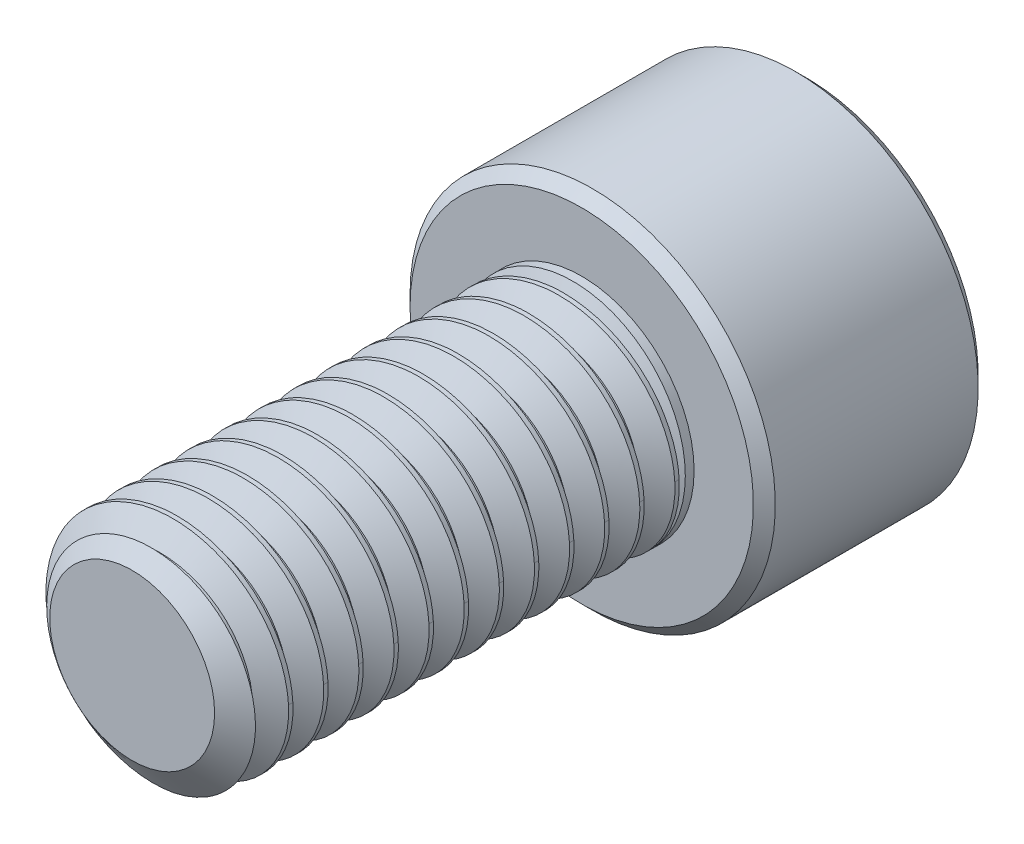
from build123d import *

# Parameters (mm, degrees)
SKETCH1_R          = 4
EXTRUDE1_DEPTH     = 16
CUT_SWEEP1_PITCH   = 1.25
SKETCH6_R          = 6.5
EXTRUDE2_DEPTH     = 8
CUT_EXTRUDE1_DEPTH = 4.5
CHAMFER1_SIZE      = 0.39


with BuildPart() as part:
    # Sketch1 → Extrude1 (new body)
    with BuildSketch(Plane.XY):
        Circle(SKETCH1_R)
    extrude(amount=-EXTRUDE1_DEPTH)

    # Cut-Sweep1: the profile of Sketch3 profile screwed along a right-hand helix of 13.8 turns, 6 arcs to a turn; built about Z, then put on its axis
    cut_sweep1_z = Axis((0, 0, 0), (0, 0, 1))
    cut_sweep1_corners = [(4.0003, 0, -1.093923205), (3.188101184, 0, -0.625), (3.188101184, 0, -0.46875), (4.0003, 0, 0.000173205)]
    with BuildLine(mode=Mode.PRIVATE) as cut_sweep1_profile:
        Line(cut_sweep1_corners[0], cut_sweep1_corners[1])
        Line(cut_sweep1_corners[1], cut_sweep1_corners[2])
        Line(cut_sweep1_corners[2], cut_sweep1_corners[3])
        Line(cut_sweep1_corners[3], cut_sweep1_corners[0])
    cut_sweep1_cap = Face(cut_sweep1_profile.wire())
    cut_sweep1_turn_angles = [0, 30, 60, 90, 120, 150, 180, 210, 240, 270, 300, 330, 360]
    cut_sweep1_turn_weights = [1, 0.8660254037844387, 1, 0.8660254037844387, 1, 0.8660254037844387, 1, 0.8660254037844387, 1, 0.8660254037844387, 1, 0.8660254037844387, 1]
    cut_sweep1_turn_rails = [Edge.make_bspline([Vector(p[0], p[1], 0).rotate(cut_sweep1_z, cut_sweep1_turn_angles[k]) / cut_sweep1_turn_weights[k] + Vector(0, 0, p[2] + CUT_SWEEP1_PITCH * cut_sweep1_turn_angles[k] / 360) for k in range(13)], [0, 0, 0, 1, 1, 2, 2, 3, 3, 4, 4, 5, 5, 6, 6, 6], 2, cut_sweep1_turn_weights) for p in cut_sweep1_corners]
    cut_sweep1_turn_sides = [Face.make_surface_from_curves(cut_sweep1_turn_rails[p[0]], cut_sweep1_turn_rails[p[1]]) for p in [(0, 1), (1, 2), (2, 3), (3, 0)]]
    cut_sweep1_last_angles = [4680, 4710, 4740, 4770, 4800, 4830, 4860, 4890, 4920, 4944, 4968]
    cut_sweep1_last_weights = [1, 0.8660254037844387, 1, 0.8660254037844387, 1, 0.8660254037844387, 1, 0.8660254037844387, 1, 0.9135454576426203, 1]
    cut_sweep1_last_rails = [Edge.make_bspline([Vector(p[0], p[1], 0).rotate(cut_sweep1_z, cut_sweep1_last_angles[k]) / cut_sweep1_last_weights[k] + Vector(0, 0, p[2] + CUT_SWEEP1_PITCH * cut_sweep1_last_angles[k] / 360) for k in range(11)], [0, 0, 0, 1, 1, 2, 2, 3, 3, 4, 4, 5, 5, 5], 2, cut_sweep1_last_weights) for p in cut_sweep1_corners]
    cut_sweep1_last_sides = [Face.make_surface_from_curves(cut_sweep1_last_rails[p[0]], cut_sweep1_last_rails[p[1]]) for p in [(0, 1), (1, 2), (2, 3), (3, 0)]]
    cut_sweep1 = Plane(origin=(0, 0, 0), x_dir=(0, 1, 0), z_dir=(0, 0, -1)) * Solid(Shell([*[p.moved(Location((0, 0, CUT_SWEEP1_PITCH * i))) for i in range(13) for p in cut_sweep1_turn_sides], *cut_sweep1_last_sides, cut_sweep1_cap, cut_sweep1_cap.rotate(cut_sweep1_z, 4968).moved(Location((0, 0, CUT_SWEEP1_PITCH * 4968 / 360)))]))
    add(cut_sweep1, mode=Mode.SUBTRACT)

    # Sketch4 → Cut-Revolve1 (revolve, cut)
    with BuildSketch(Plane(origin=(0, 0, 0), x_dir=(0, 0, -1), z_dir=(1, 0, 0)), mode=Mode.PRIVATE) as cut_revolve1_sk:
        Polygon((0.746350386, 4), (0, 2.934101184), (0, 4), align=None)
    revolve(cut_revolve1_sk.sketch.rotate(Axis((0, 0, 0), (0, 0, -1)), 230.713364492), axis=Axis((0, 0, 0), (0, 0, -1)), mode=Mode.SUBTRACT)

    # Sketch6 → Extrude2 (add)
    with BuildSketch(Plane(origin=(0, 0, -16), x_dir=(-1, 0, 0), z_dir=(0, 0, -1))):
        Circle(SKETCH6_R)
    extrude(amount=EXTRUDE2_DEPTH)

    # Sketch7 → Cut-Extrude1 (cut)
    with BuildSketch(Plane(origin=(0, 0, -24), x_dir=(-1, 0, 0), z_dir=(0, 0, -1))):
        Polygon((0, 3.464101615), (-3, 1.732050808), (-3, -1.732050808), (0, -3.464101615), (3, -1.732050808), (3, 1.732050808), align=None)
    extrude(amount=-CUT_EXTRUDE1_DEPTH, mode=Mode.SUBTRACT)

    # Cut-Extrude2 cone 1 section (through the dimple's axis) → Cut-Extrude2 (revolve, cut)
    with BuildSketch(Plane(origin=(0, 0, -24), x_dir=(0, 1, 0), z_dir=(1, 0, 0))):
        Polygon((0, 0), (3.464101615, 0), (0, 3.464101615), align=None)
    revolve(axis=Axis((0, 0, -24), (0, 0, 1)), mode=Mode.SUBTRACT)

    # Chamfer1
    chamfer1_edges = [part.edges().sort_by_distance(p)[0] for p in [
        (6.5, 0, -16),
        (6.5, 0, -24),
    ]]
    chamfer(chamfer1_edges, length=CHAMFER1_SIZE)

    # Sketch10 → Revolve1 (revolve)
    with BuildSketch(Plane(origin=(0, 0, 0), x_dir=(0, 0, -1), z_dir=(1, 0, 0)), mode=Mode.PRIVATE) as revolve1_sk:
        Polygon((16, 4), (16, 0), (14.030645751, 0), (15.6875, 4), align=None)
    revolve(revolve1_sk.sketch.rotate(Axis((0, 0, -16), (0, 0, 1)), 270), axis=Axis((0, 0, -16), (0, 0, 1)))


solid = part.part
